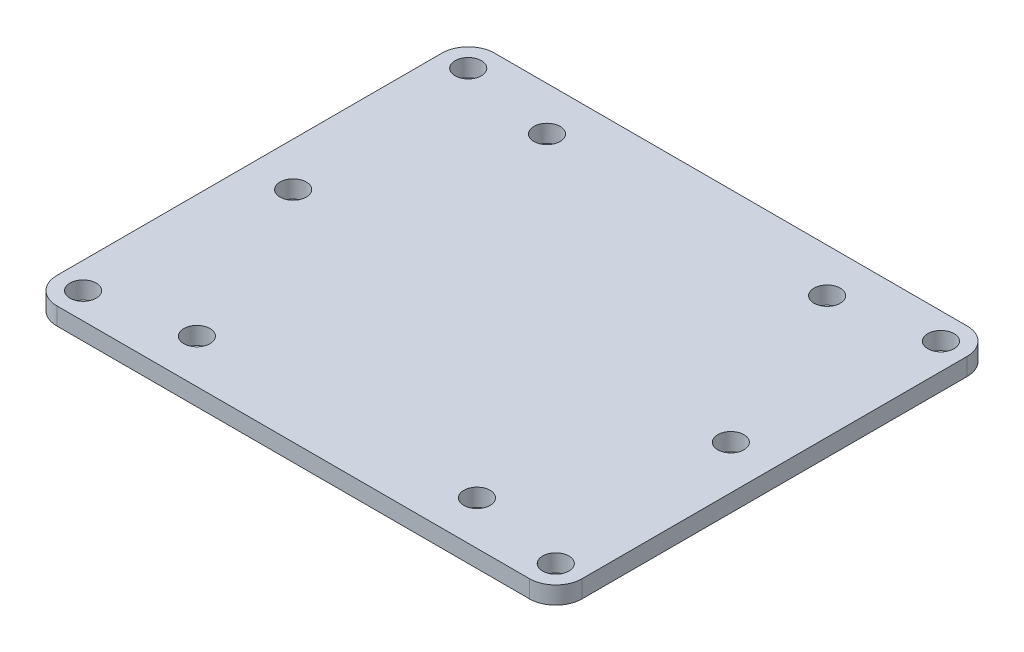
from build123d import *

# Parameters (mm, degrees)
SKETCH_1_W          = 60
SKETCH_1_H          = 50
EXTRUDE_1_DEPTH     = 2
SKETCH_2_R          = 1.5
CUT_EXTRUDE_1_DEPTH = 40.102429592
FILLET_1_R          = 3


with BuildPart() as part:
    # 草图1 → 凸台-拉伸1 (new body)
    with BuildSketch(Plane(origin=(0, 0, 0), x_dir=(1, 0, 0), z_dir=(0, 1, 0))):
        Rectangle(SKETCH_1_W, SKETCH_1_H)
    extrude(amount=EXTRUDE_1_DEPTH)

    # 草图2 → 切除-拉伸1 (cut, through all)
    with BuildSketch(Plane(origin=(0, 2, 0), x_dir=(1, 0, 0), z_dir=(0, 1, 0))):
        with Locations((-16, 20)):
            Circle(SKETCH_2_R)
        with Locations((-25, 0)):
            Circle(SKETCH_2_R)
        with Locations((-16, -20)):
            Circle(SKETCH_2_R)
        with Locations((16, -20)):
            Circle(SKETCH_2_R)
        with Locations((25, 0)):
            Circle(SKETCH_2_R)
        with Locations((16, 20)):
            Circle(SKETCH_2_R)
        with Locations((-27, 22)):
            Circle(SKETCH_2_R)
        with Locations((-27, -22)):
            Circle(SKETCH_2_R)
        with Locations((27, -22)):
            Circle(SKETCH_2_R)
        with Locations((27, 22)):
            Circle(SKETCH_2_R)
    extrude(amount=-CUT_EXTRUDE_1_DEPTH, mode=Mode.SUBTRACT)

    # 圆角1
    fillet_1_edges = [part.edges().sort_by_distance(p)[0] for p in [
        (-30, 1, 25),
        (30, 1, 25),
        (30, 1, -25),
        (-30, 1, -25),
    ]]
    fillet(fillet_1_edges, radius=FILLET_1_R)


solid = part.part
